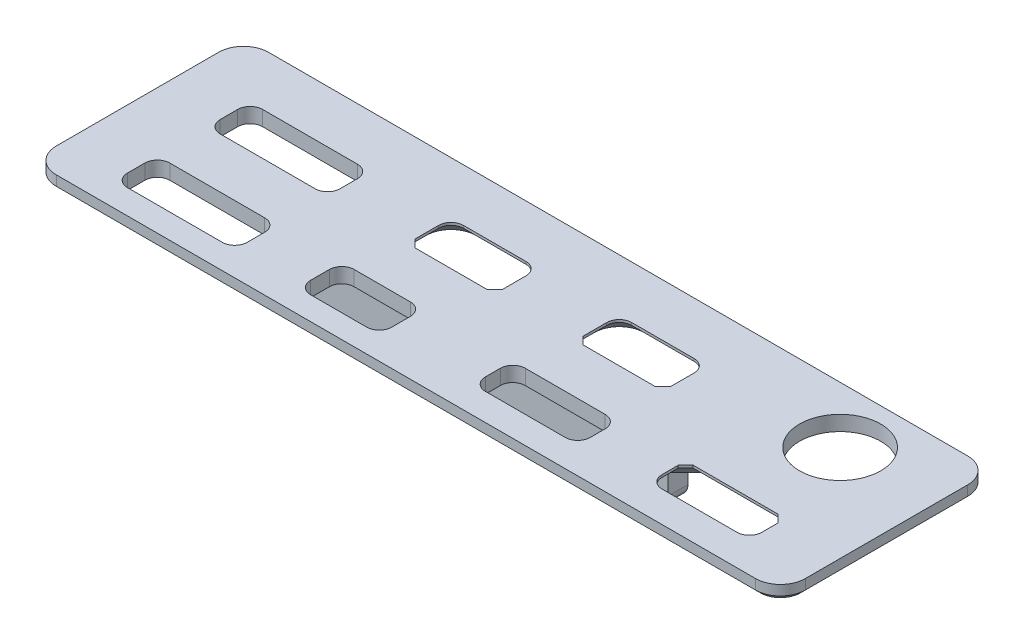
from build123d import *

# Parameters (mm, degrees)
SKETCH_1_W          = 60
SKETCH_1_H          = 17
EXTRUDE_1_DEPTH     = 1.2
CUT_EXTRUDE_1_REACH = 33.204
SKETCH_4_R          = 3.25
SKETCH_4_W          = 9.6
SKETCH_4_H          = 3.4
SKETCH_4_W_2        = 7
SKETCH_4_H_2        = 3.5
SKETCH_4_W_3        = 8
SKETCH_4_H_3        = 2.9
SKETCH_4_W_4        = 8.4
SKETCH_4_H_4        = 3.2
SKETCH_4_W_5        = 6.5
FILLET_2_R          = 1
CHAMFER_1_SIZE      = 0.6
SKETCH_5_W          = 1.5
SKETCH_5_H          = 8
EXTRUDE_2_DEPTH     = 1.2
SKETCH_6_W          = 28.5
SKETCH_6_H          = 1.6
EXTRUDE_3_DEPTH     = 4
FILLET_3_R          = 1
CHAMFER_2_SIZE      = 1
CHAMFER_4_SIZE      = 1
FILLET_4_R          = 2
CHAMFER_5_SIZE      = 0.4


with BuildPart() as part:
    # 草图1 → 凸台-拉伸1 (new body)
    with BuildSketch(Plane(origin=(0, 0, 0), x_dir=(1, 0, 0), z_dir=(0, 1, 0))):
        Rectangle(SKETCH_1_W, SKETCH_1_H)
    extrude(amount=EXTRUDE_1_DEPTH)

    # 草图4 → 切除-拉伸1 (cut, up to next)
    with BuildSketch(Plane(origin=(0, 1.2, 0), x_dir=(1, 0, 0), z_dir=(0, 1, 0)), mode=Mode.PRIVATE) as cut_extrude_1_sk1:
        with Locations((22.298485985, 3.98318929)):
            Circle(SKETCH_4_R)
    cut_extrude_1_tool1 = extrude(cut_extrude_1_sk1.sketch, amount=-CUT_EXTRUDE_1_REACH, mode=Mode.PRIVATE) & part.part
    # 草图4 → 切除-拉伸1 (cut, up to next)
    with BuildSketch(Plane(origin=(0, 1.2, 0), x_dir=(1, 0, 0), z_dir=(0, 1, 0)), mode=Mode.PRIVATE) as cut_extrude_1_sk2:
        with Locations((-20.471722325, 2.6)):
            Rectangle(SKETCH_4_W, SKETCH_4_H)
    cut_extrude_1_tool2 = extrude(cut_extrude_1_sk2.sketch, amount=-CUT_EXTRUDE_1_REACH, mode=Mode.PRIVATE) & part.part
    # 草图4 → 切除-拉伸1 (cut, up to next)
    with BuildSketch(Plane(origin=(0, 1.2, 0), x_dir=(1, 0, 0), z_dir=(0, 1, 0)), mode=Mode.PRIVATE) as cut_extrude_1_sk3:
        with Locations((-5.682926277, 2.55)):
            Rectangle(SKETCH_4_W_2, SKETCH_4_H_2)
    cut_extrude_1_tool3 = extrude(cut_extrude_1_sk3.sketch, amount=-CUT_EXTRUDE_1_REACH, mode=Mode.PRIVATE) & part.part
    # 草图4 → 切除-拉伸1 (cut, up to next)
    with BuildSketch(Plane(origin=(0, 1.2, 0), x_dir=(1, 0, 0), z_dir=(0, 1, 0)), mode=Mode.PRIVATE) as cut_extrude_1_sk4:
        with Locations((7.788485985, 2.55)):
            Rectangle(SKETCH_4_W_2, SKETCH_4_H_2)
    cut_extrude_1_tool4 = extrude(cut_extrude_1_sk4.sketch, amount=-CUT_EXTRUDE_1_REACH, mode=Mode.PRIVATE) & part.part
    # 草图4 → 切除-拉伸1 (cut, up to next)
    with BuildSketch(Plane(origin=(0, 1.2, 0), x_dir=(1, 0, 0), z_dir=(0, 1, 0)), mode=Mode.PRIVATE) as cut_extrude_1_sk5:
        with Locations((21.05, -4.584803861)):
            Rectangle(SKETCH_4_W_3, SKETCH_4_H_3)
    cut_extrude_1_tool5 = extrude(cut_extrude_1_sk5.sketch, amount=-CUT_EXTRUDE_1_REACH, mode=Mode.PRIVATE) & part.part
    # 草图4 → 切除-拉伸1 (cut, up to next)
    with BuildSketch(Plane(origin=(0, 1.2, 0), x_dir=(1, 0, 0), z_dir=(0, 1, 0)), mode=Mode.PRIVATE) as cut_extrude_1_sk6:
        with Locations((7.4, -4.734803861)):
            Rectangle(SKETCH_4_W_4, SKETCH_4_H_4)
    cut_extrude_1_tool6 = extrude(cut_extrude_1_sk6.sketch, amount=-CUT_EXTRUDE_1_REACH, mode=Mode.PRIVATE) & part.part
    # 草图4 → 切除-拉伸1 (cut, up to next)
    with BuildSketch(Plane(origin=(0, 1.2, 0), x_dir=(1, 0, 0), z_dir=(0, 1, 0)), mode=Mode.PRIVATE) as cut_extrude_1_sk7:
        with Locations((-7.25, -4.884803861)):
            Rectangle(SKETCH_4_W_5, SKETCH_4_H_2)
    cut_extrude_1_tool7 = extrude(cut_extrude_1_sk7.sketch, amount=-CUT_EXTRUDE_1_REACH, mode=Mode.PRIVATE) & part.part
    # 草图4 → 切除-拉伸1 (cut, up to next)
    with BuildSketch(Plane(origin=(0, 1.2, 0), x_dir=(1, 0, 0), z_dir=(0, 1, 0)), mode=Mode.PRIVATE) as cut_extrude_1_sk8:
        with Locations((-20.471722325, -4.834803861)):
            Rectangle(SKETCH_4_W, SKETCH_4_H)
    cut_extrude_1_tool8 = extrude(cut_extrude_1_sk8.sketch, amount=-CUT_EXTRUDE_1_REACH, mode=Mode.PRIVATE) & part.part
    add(cut_extrude_1_tool1.solids().sort_by_distance((22.298486, 1.2, -3.983189))[0], mode=Mode.SUBTRACT)
    add(cut_extrude_1_tool2.solids().sort_by_distance((-20.471722, 1.2, -2.6))[0], mode=Mode.SUBTRACT)
    add(cut_extrude_1_tool3.solids().sort_by_distance((-5.682926, 1.2, -2.55))[0], mode=Mode.SUBTRACT)
    add(cut_extrude_1_tool4.solids().sort_by_distance((7.788486, 1.2, -2.55))[0], mode=Mode.SUBTRACT)
    add(cut_extrude_1_tool5.solids().sort_by_distance((21.05, 1.2, 4.584804))[0], mode=Mode.SUBTRACT)
    add(cut_extrude_1_tool6.solids().sort_by_distance((7.4, 1.2, 4.734804))[0], mode=Mode.SUBTRACT)
    add(cut_extrude_1_tool7.solids().sort_by_distance((-7.25, 1.2, 4.884804))[0], mode=Mode.SUBTRACT)
    add(cut_extrude_1_tool8.solids().sort_by_distance((-20.471722, 1.2, 4.834804))[0], mode=Mode.SUBTRACT)

    # 圆角2
    fillet_2_edges = [part.edges().sort_by_distance(p)[0] for p in [
        (-25.271722325, 0.6, -0.9),
        (-25.271722325, 0.6, -4.3),
        (-15.671722325, 0.6, -0.9),
        (-15.671722325, 0.6, -4.3),
        (-2.182926277, 0.6, -4.3),
        (-9.182926277, 0.6, -4.3),
        (4.288485985, 0.6, -4.3),
        (11.288485985, 0.6, -4.3),
        (25.05, 0.6, 6.034803861),
        (17.05, 0.6, 6.034803861),
        (11.6, 0.6, 6.334803861),
        (11.6, 0.6, 3.134803861),
        (3.2, 0.6, 3.134803861),
        (3.2, 0.6, 6.334803861),
        (-4, 0.6, 6.634803861),
        (-4, 0.6, 3.134803861),
        (-10.5, 0.6, 3.134803861),
        (-10.5, 0.6, 6.634803861),
        (-15.671722325, 0.6, 6.534803861),
        (-15.671722325, 0.6, 3.134803861),
        (-25.271722325, 0.6, 3.134803861),
        (-25.271722325, 0.6, 6.534803861),
    ]]
    fillet(fillet_2_edges, radius=FILLET_2_R)

    # 倒角1
    chamfer_1_edges = [part.edges().sort_by_distance(p)[0] for p in [
        (-9.182926277, 0.6, -0.8),
        (-2.182926277, 0.6, -0.8),
        (4.288485985, 0.6, -0.8),
        (11.288485985, 0.6, -0.8),
        (17.05, 0.6, 3.134803861),
        (25.05, 0.6, 3.134803861),
    ]]
    chamfer(chamfer_1_edges, length=CHAMFER_1_SIZE)

    # 草图5 → 凸台-拉伸2 (add)
    with BuildSketch(Plane.XZ):
        with Locations((-13.15891381, 0.61681071)):
            Rectangle(SKETCH_5_W, SKETCH_5_H)
        with Locations((13.84108619, 0.61681071)):
            Rectangle(SKETCH_5_W, SKETCH_5_H)
    extrude(amount=EXTRUDE_2_DEPTH)

    # 草图6 → 凸台-拉伸3 (add)
    with BuildSketch(Plane.XZ):
        with Locations((0.34108619, 1.3)):
            Rectangle(SKETCH_6_W, SKETCH_6_H)
    extrude(amount=EXTRUDE_3_DEPTH)

    # 圆角3
    fillet_3_edges = [part.edges().sort_by_distance(p)[0] for p in [
        (14.59108619, -4, 1.3),
        (-13.90891381, -4, 1.3),
    ]]
    fillet(fillet_3_edges, radius=FILLET_3_R)

    # 倒角2
    chamfer_2_edges = [part.edges().sort_by_distance(p)[0] for p in [
        (13.84108619, -1.2, -3.38318929),
        (-13.15891381, -1.2, -3.38318929),
        (13.84108619, -1.2, 4.61681071),
        (-13.15891381, -1.2, 4.61681071),
    ]]
    chamfer(chamfer_2_edges, length=CHAMFER_2_SIZE)

    # 倒角4
    chamfer_4_edges = [part.edges().sort_by_distance(p)[0] for p in [
        (11.288485985, 0, -2.35),
        (10.995592766, 0, -4.007106781),
        (7.788485985, 0, -4.3),
        (4.581379204, 0, -4.007106781),
        (10.988485985, 0, -1.1),
        (4.288485985, 0, -2.35),
        (4.588485985, 0, -1.1),
        (7.788485985, 0, -0.8),
        (-9.182926277, 0, -2.35),
        (-2.182926277, 0, -2.35),
        (-8.890033058, 0, -4.007106781),
        (-2.475819496, 0, -4.007106781),
        (-5.682926277, 0, -4.3),
        (-2.482926277, 0, -1.1),
        (-8.882926277, 0, -1.1),
        (-5.682926277, 0, -0.8),
        (17.35, 0, 3.434803861),
        (21.05, 0, 3.134803861),
        (24.75, 0, 3.434803861),
        (25.05, 0, 4.384803861),
        (17.05, 0, 4.384803861),
        (24.757106781, 0, 5.741910642),
        (17.342893219, 0, 5.741910642),
        (21.05, 0, 6.034803861),
    ]]
    chamfer(chamfer_4_edges, length=CHAMFER_4_SIZE)

    # 圆角4
    fillet_4_edges = [part.edges().sort_by_distance(p)[0] for p in [
        (30, 0.6, 8.5),
        (30, 0.6, -8.5),
        (-30, 0.6, 8.5),
        (-30, 0.6, -8.5),
    ]]
    fillet(fillet_4_edges, radius=FILLET_4_R)

    # 倒角5
    chamfer_5_edges = [part.edges().sort_by_distance(p)[0] for p in [
        (0, 0, -8.5),
        (-29.414213562, 0, -7.914213562),
        (29.414213562, 0, -7.914213562),
        (-30, 0, 0),
        (30, 0, 0),
        (-29.414213562, 0, 7.914213562),
        (29.414213562, 0, 7.914213562),
        (0, 0, 8.5),
    ]]
    chamfer(chamfer_5_edges, length=CHAMFER_5_SIZE)


solid = part.part
